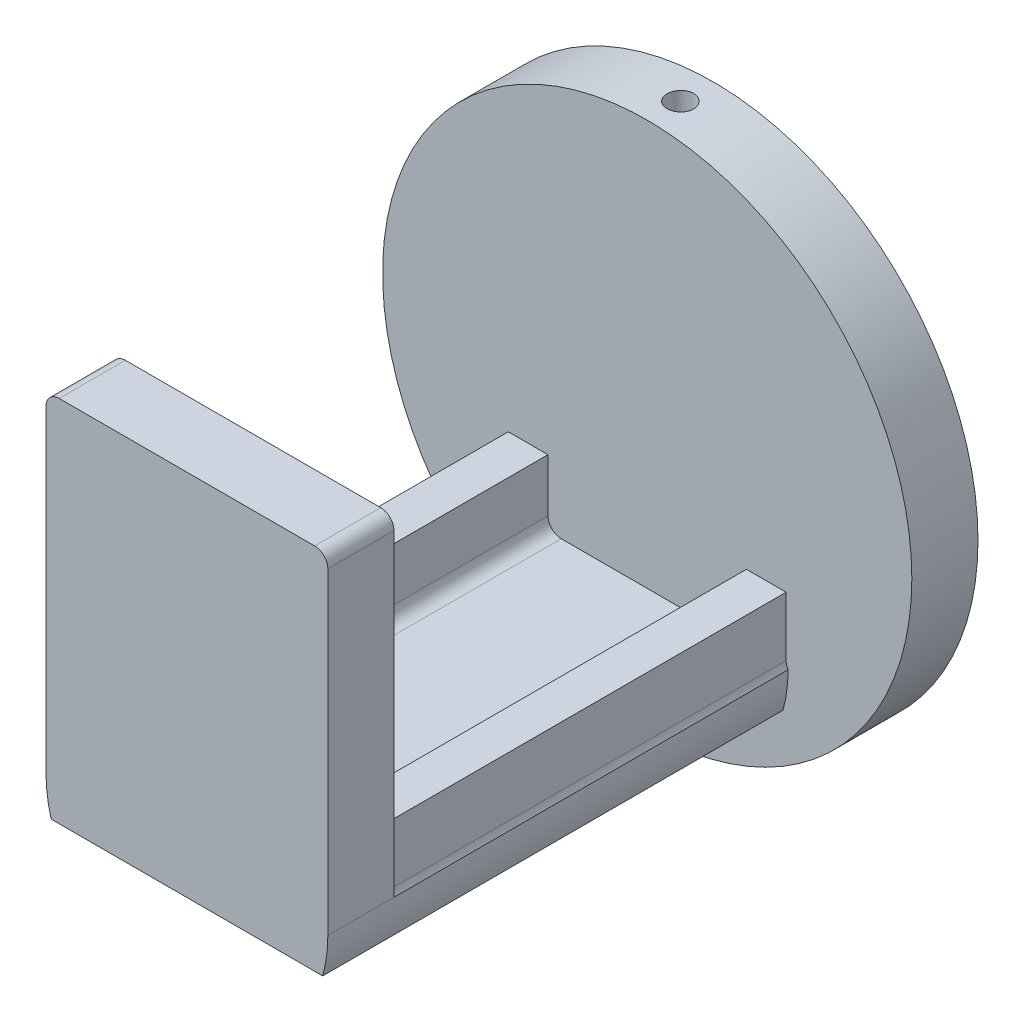
from build123d import *

# Parameters (mm, degrees)
SKETCH1_R               = 20
BOSS_EXTRUDE1_DEPTH     = 5
BOSS_EXTRUDE2_DEPTH     = 34.79
SKETCH3_W               = 21.3
SKETCH3_H               = 5
BOSS_EXTRUDE3_DEPTH     = 25
SKETCH4_W               = 3
SKETCH4_H               = 29.79
BOSS_EXTRUDE5_DEPTH     = 5
CUT_EXTRUDE1_DEPTH      = 38
CUT_EXTRUDE1_DEPTH_BACK = 45.836860952
SKETCH5_R               = 1
FILLET1_R               = 1
FILLET2_R               = 1
FILLET3_R               = 1
CUT_EXTRUDE2_REACH      = 50.818
CUT_EXTRUDE2_END_RADIUS = 1
SKETCH6_R               = 0.5


with BuildPart() as part:
    # Sketch1 → Boss-Extrude1 (new body)
    with BuildSketch(Plane.XY):
        Circle(SKETCH1_R)
    extrude(amount=-BOSS_EXTRUDE1_DEPTH)

    # Sketch2 → Boss-Extrude2 (add)
    with BuildSketch(Plane.XY):
        with BuildLine():
            Line((-10.65, -10.65), (10.65, -10.65))
            ThreePointArc((10.65, -10.65), (10.553147336, -12.083032205), (10.264350929, -13.49))
            Line((10.264350929, -13.49), (-10.264350929, -13.49))
            ThreePointArc((-10.264350929, -13.49), (-10.553147336, -12.083032205), (-10.65, -10.65))
        make_face()
    extrude(amount=BOSS_EXTRUDE2_DEPTH)

    # Sketch3 → Boss-Extrude3 (add)
    with BuildSketch(Plane(origin=(0, -10.65, 0), x_dir=(1, 0, 0), z_dir=(0, 1, 0))):
        with Locations((0, -32.29)):
            Rectangle(SKETCH3_W, SKETCH3_H)
    extrude(amount=BOSS_EXTRUDE3_DEPTH)

    # Sketch4 → Boss-Extrude5 (add)
    with BuildSketch(Plane(origin=(0, -10.65, 0), x_dir=(1, 0, 0), z_dir=(0, 1, 0))):
        with Locations((9, -14.895)):
            Rectangle(SKETCH4_W, SKETCH4_H)
        with Locations((-9, -14.895)):
            Rectangle(SKETCH4_W, SKETCH4_H)
    extrude(amount=BOSS_EXTRUDE5_DEPTH)

    # Sketch5 → Cut-Extrude1 (cut, two sides: drawn at the far end of the back side and taken through both)
    with BuildSketch(Plane(origin=(0, 0, 0), x_dir=(1, 0, 0), z_dir=(0, 1, 0)).offset(-CUT_EXTRUDE1_DEPTH_BACK)):
        with Locations(Location((0, 2.5, 0), (0, 0, 90))):
            Circle(SKETCH5_R)
    extrude(amount=CUT_EXTRUDE1_DEPTH + CUT_EXTRUDE1_DEPTH_BACK, mode=Mode.SUBTRACT)

    # Fillet1
    fillet1_edges = [part.edges().sort_by_distance(p)[0] for p in [
        (10.65, 14.35, 32.29),
        (-10.65, 14.35, 32.29),
    ]]
    fillet(fillet1_edges, radius=FILLET1_R)

    # Fillet2
    fillet2_edges = [part.edges().sort_by_distance(p)[0] for p in [
        (7.5, -10.65, 14.895),
        (-7.5, -10.65, 14.895),
    ]]
    fillet(fillet2_edges, radius=FILLET2_R)

    # Fillet3
    # the kernel refuses this fillet: 1 mm, written as the material it adds along each edge
    with BuildSketch(Plane(origin=(10.5, -10.65, 31.106956719), x_dir=(0, 1, 0), z_dir=(0, 0, -1))) as fillet3_piece_1:
        with BuildLine():
            CenterArc((0.526782688, 1), FILLET3_R, 238.211669382, 31.788330618)
            Line((0, 0.15), (-0.010535654, 0.133))
            ThreePointArc((-0.010535654, 0.133), (-0.02, 0.075), (-0.02, 0))
            Line((-0.02, 0), (0, -0.02))
            Line((0, -0.02), (0.526782688, -0.02))
            Line((0.526782688, -0.02), (0.526782688, 0))
        make_face()
    extrude(amount=32.423913438)
    with BuildSketch(Plane(origin=(-10.5, -10.65, 31.106956719), x_dir=(0, 1, 0), z_dir=(0, 0, -1))) as fillet3_piece_2:
        with BuildLine():
            CenterArc((0.526782688, -1), FILLET3_R, 90, 31.788330618)
            Line((0, -0.15), (-0.010535654, -0.133))
            ThreePointArc((-0.010535654, -0.133), (-0.02, -0.075), (-0.02, 0))
            Line((-0.02, 0), (0, 0.02))
            Line((0, 0.02), (0.526782688, 0.02))
            Line((0.526782688, 0.02), (0.526782688, 0))
        make_face()
    extrude(amount=32.423913438)

    # Cut-Extrude2: up to this cylinder (the profile starts outside it)
    cut_extrude2_end = Plane(origin=(0, 0, -2.5), z_dir=(0, -1, 0)) * Cylinder(CUT_EXTRUDE2_END_RADIUS, 126.636, mode=Mode.PRIVATE)
    # Sketch6 → Cut-Extrude2 (cut, up to the surface)
    with BuildSketch(Plane(origin=(0, 0, -5), x_dir=(-1, 0, 0), z_dir=(0, 0, -1)), mode=Mode.PRIVATE) as cut_extrude2_sk1:
        with Locations((0, 11)):
            Circle(SKETCH6_R)
    cut_extrude2_tool1 = extrude(cut_extrude2_sk1.sketch, amount=-CUT_EXTRUDE2_REACH, mode=Mode.PRIVATE) - cut_extrude2_end
    add(cut_extrude2_tool1.solids().sort_by_distance((0, 11, -5))[0], mode=Mode.SUBTRACT)
    # Sketch6 → Cut-Extrude2 (cut, up to the surface)
    with BuildSketch(Plane(origin=(0, 0, -5), x_dir=(-1, 0, 0), z_dir=(0, 0, -1)), mode=Mode.PRIVATE) as cut_extrude2_sk2:
        with Locations((0, -11)):
            Circle(SKETCH6_R)
    cut_extrude2_tool2 = extrude(cut_extrude2_sk2.sketch, amount=-CUT_EXTRUDE2_REACH, mode=Mode.PRIVATE) - cut_extrude2_end
    add(cut_extrude2_tool2.solids().sort_by_distance((0, -11, -5))[0], mode=Mode.SUBTRACT)


solid = part.part
